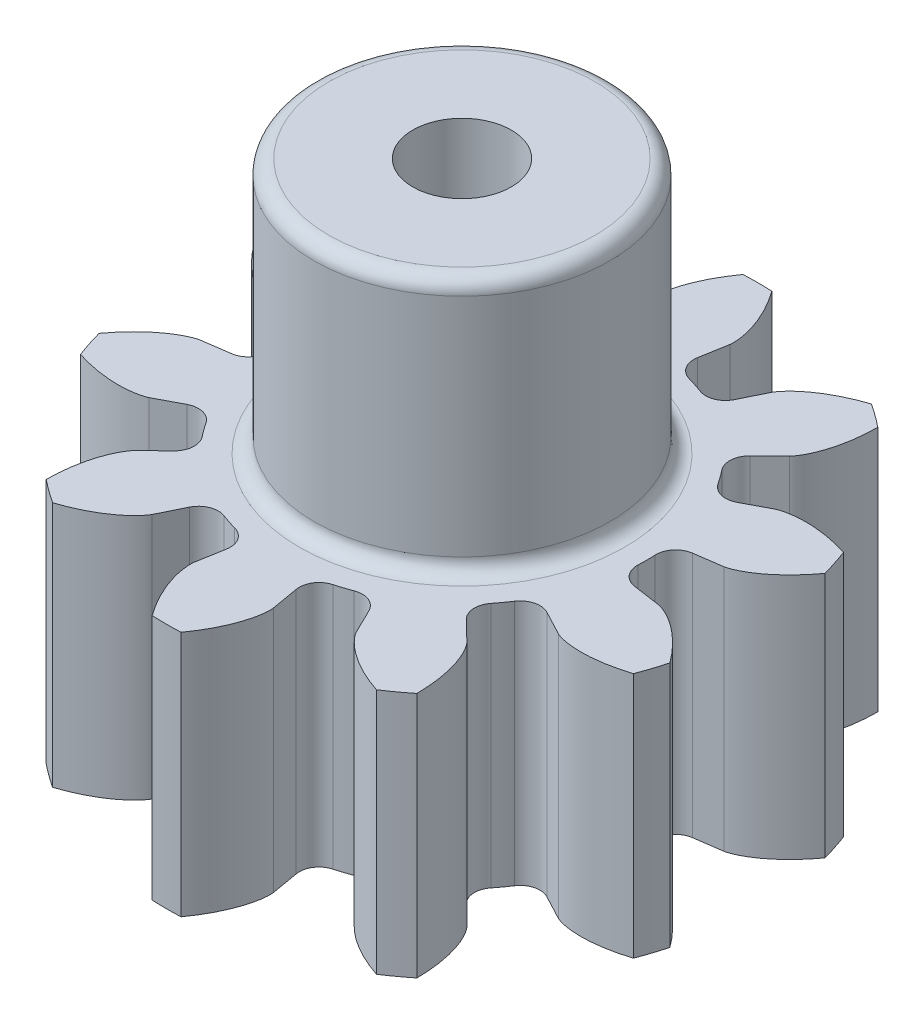
from build123d import *

# Parameters (mm, degrees)
SKETCH2_R                = 15.24
BOSS_EXTRUDE1_DEPTH      = 12.7
CUT_EXTRUDE1_DEPTH       = 26.016098817
FILLET1_R                = 1.016
CIRPATTERN1_COUNT        = 10
FILLET1_OF_CIRPATTERN1_R = 1.016
SKETCH4_R                = 7.62
BOSS_EXTRUDE2_DEPTH      = 13.16
SKETCH5_R                = 2.54
CUT_EXTRUDE2_DEPTH       = 34.426056363
FILLET2_R                = 0.762


with BuildPart() as part:
    # Sketch2 → Boss-Extrude1 (new body)
    with BuildSketch(Plane(origin=(0, 0, 0), x_dir=(1, 0, 0), z_dir=(0, 1, 0))):
        Circle(SKETCH2_R)
    extrude(amount=BOSS_EXTRUDE1_DEPTH)

    # Sketch3 → Cut-Extrude1 (cut, through all)
    with BuildSketch(Plane(origin=(0, 0, 0), x_dir=(-1, 0, 0), z_dir=(0, -1, 0))):
        with BuildLine():
            Line((9.428893824, -1.349661534), (11.813682598, -1.691022645))
            add(Edge.make_bspline(
                [(11.813682598, -1.691022645), (11.819178365, -1.691903787), (11.834545167, -1.694660871), (11.863400401, -1.700999964), (11.910150555, -1.712933326), (11.969184939, -1.730464153), (12.04479756, -1.755773638), (12.132910439, -1.7889748), (12.228645625, -1.82897949), (12.331522072, -1.876262838), (12.432952776, -1.926731697), (12.532947922, -1.980115008), (12.631445021, -2.036015147), (12.749370299, -2.106907896), (12.888801103, -2.196315459), (13.048717462, -2.307123688), (13.226338861, -2.440160727), (13.403109396, -2.583451627), (13.573472712, -2.730730451), (13.741256687, -2.886575073), (13.90049908, -3.042342342), (14.06117781, -3.211114463), (14.207107268, -3.370471575), (14.365124352, -3.556498071), (14.491066541, -3.708832868), (14.616438915, -3.872275149), (14.676753563, -3.95271226), (14.707278225, -3.994191683)],
                knots=[0, 0, 0, 0, 0, 0.005376749, 0.015083688, 0.02853182, 0.046610139, 0.064854849, 0.092110525, 0.119476176, 0.146842496, 0.174208854, 0.201574956, 0.228941013, 0.256307345, 0.307035032, 0.361767352, 0.41649966, 0.471231936, 0.525964282, 0.580696615, 0.635428982, 0.690161387, 0.744893688, 0.799626082, 0.854358408, 0.909090915, 0.909090915, 0.909090915, 0.909090915, 0.909090915], degree=4))
            ThreePointArc((14.707278225, -3.994191683), (15.24, 0), (14.707278225, 3.994191683))
            add(Edge.make_bspline(
                [(14.707278225, 3.994191683), (14.676753563, 3.95271226), (14.616438915, 3.872275149), (14.491066541, 3.708832868), (14.365124352, 3.556498071), (14.207107268, 3.370471575), (14.06117781, 3.211114463), (13.90049908, 3.042342342), (13.741256687, 2.886575073), (13.573472712, 2.730730451), (13.403109396, 2.583451627), (13.226338861, 2.440160727), (13.048717462, 2.307123688), (12.888801103, 2.196315459), (12.749370299, 2.106907896), (12.631445021, 2.036015147), (12.532947922, 1.980115008), (12.432952776, 1.926731697), (12.331522072, 1.876262838), (12.228645625, 1.82897949), (12.132910439, 1.7889748), (12.04479756, 1.755773638), (11.969184939, 1.730464153), (11.910150555, 1.712933326), (11.863400401, 1.700999964), (11.834545167, 1.694660871), (11.819178365, 1.691903787), (11.813682598, 1.691022645)],
                knots=[0.190928826, 0.190928826, 0.190928826, 0.190928826, 0.190928826, 0.245661333, 0.300393658, 0.355126053, 0.409858354, 0.464590759, 0.519323125, 0.574055459, 0.628787804, 0.68352008, 0.738252389, 0.792984709, 0.843712396, 0.871078728, 0.898444785, 0.925810887, 0.953177245, 0.980543565, 1.007909216, 1.035164892, 1.053409601, 1.071487921, 1.084936053, 1.094642992, 1.100019741, 1.100019741, 1.100019741, 1.100019741, 1.100019741], degree=4))
            Line((11.813682598, 1.691022645), (9.428893824, 1.349661534))
            ThreePointArc((9.428893824, 1.349661534), (9.525, 0), (9.428893824, -1.349661534))
        make_face()
    cut_extrude1 = extrude(amount=-CUT_EXTRUDE1_DEPTH, mode=Mode.SUBTRACT)

    # Fillet1
    fillet1_edges = [part.edges().sort_by_distance(p)[0] for p in [
        (-9.428893824, 6.35, -1.349661534),
        (-9.428893824, 6.35, 1.349661534),
    ]]
    fillet(fillet1_edges, radius=FILLET1_R)

    # CirPattern1: Cut-Extrude1 ×10 about axis
    cirpattern1_axis = Axis((0, 0, 0), (0, 1, 0))
    for i in range(1, CIRPATTERN1_COUNT):
        add(cut_extrude1.rotate(cirpattern1_axis, i * 360 / CIRPATTERN1_COUNT), mode=Mode.SUBTRACT)

    # Fillet1 of CirPattern1
    fillet1_of_cirpattern1_edges = [part.edges().sort_by_distance(p)[0] for p in [
        (-8.421446487, 6.35, 4.450265617),
        (-6.834824196, 6.35, 6.634063853),
        (-4.197292826, 6.35, 8.550342562),
        (-1.630084033, 6.35, 9.384479263),
        (1.630084033, 6.35, 9.384479263),
        (4.197292826, 6.35, 8.550342562),
        (6.834824196, 6.35, 6.634063853),
        (8.421446487, 6.35, 4.450265617),
        (9.428893824, 6.35, 1.349661534),
        (9.428893824, 6.35, -1.349661534),
        (8.421446487, 6.35, -4.450265617),
        (6.834824196, 6.35, -6.634063853),
        (4.197292826, 6.35, -8.550342562),
        (1.630084033, 6.35, -9.384479263),
        (-1.630084033, 6.35, -9.384479263),
        (-4.197292826, 6.35, -8.550342562),
        (-6.834824196, 6.35, -6.634063853),
        (-8.421446487, 6.35, -4.450265617),
    ]]
    fillet(fillet1_of_cirpattern1_edges, radius=FILLET1_OF_CIRPATTERN1_R)

    # Sketch4 → Boss-Extrude2 (add)
    with BuildSketch(Plane(origin=(0, 12.7, 0), x_dir=(1, 0, 0), z_dir=(0, 1, 0))):
        Circle(SKETCH4_R)
    extrude(amount=BOSS_EXTRUDE2_DEPTH)

    # Sketch5 → Cut-Extrude2 (cut, through all)
    with BuildSketch(Plane(origin=(0, 25.86, 0), x_dir=(1, 0, 0), z_dir=(0, 1, 0))):
        Circle(SKETCH5_R)
    extrude(amount=-CUT_EXTRUDE2_DEPTH, mode=Mode.SUBTRACT)

    # Fillet2
    fillet2_edges = [part.edges().sort_by_distance(p)[0] for p in [
        (-7.62, 25.86, 0),
        (-7.62, 12.7, 0),
    ]]
    fillet(fillet2_edges, radius=FILLET2_R)


solid = part.part
